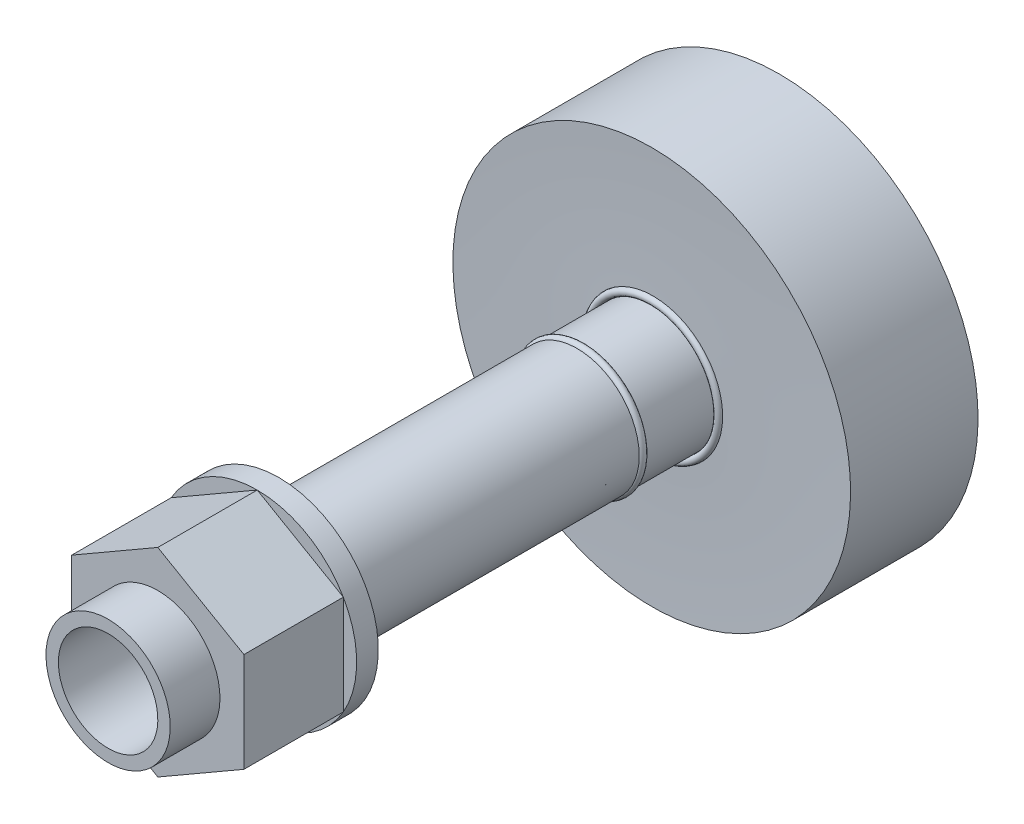
from build123d import *

# Parameters (mm, degrees)
SKETCH2_R          = 47.475732925
CUT_EXTRUDE1_DEPTH = 40
SKETCH3_W          = 3
SKETCH3_H          = 2
SKETCH3_W_2        = 2
SKETCH3_H_2        = 3
SKETCH4_W          = 2
SKETCH4_H          = 3
SKETCH5_R          = 1.5
SKETCH5_R_2        = 1.464909104
SKETCH5_R_3        = 1.4
SKETCH5_R_4        = 1.438808622


with BuildPart() as part:
    # Sketch1 → Revolve1 (revolve)
    with BuildSketch(Plane(origin=(0, 0, 0), x_dir=(0, 0, -1), z_dir=(1, 0, 0))):
        with BuildLine():
            Line((-146.746161077, 20), (123.253838923, 20))
            Line((123.253838923, 20), (123.253838923, 80))
            Line((123.253838923, 80), (71.96969697, 80))
            ThreePointArc((71.96969697, 80), (72.591794071, 52.503354195), (72.457468383, 25))
            Line((72.457468383, 25), (-76.746161077, 25))
            ThreePointArc((-76.746161077, 25), (-77.355022137, 32.502843083), (-78.03030303, 40))
            Line((-78.03030303, 40), (-126.746161077, 40))
            Line((-126.746161077, 40), (-126.746161077, 25))
            Line((-126.746161077, 25), (-146.746161077, 25))
            Line((-146.746161077, 25), (-146.746161077, 20))
        make_face()
    revolve(axis=Axis((0, 0, -123.253838923), (0, 0, 1)))

    # Sketch2 → Cut-Extrude1 (cut)
    with BuildSketch(Plane.XY.offset(126.746161077)):
        Circle(SKETCH2_R)
        Polygon((34.641016151, -20), (34.641016151, 20), (0, 40), (-34.641016151, 20), (-34.641016151, -20), (0, -40), align=None, mode=Mode.SUBTRACT)
    extrude(amount=-CUT_EXTRUDE1_DEPTH, mode=Mode.SUBTRACT)

    # Sketch3 → Cut-Revolve1 (revolve, cut)
    with BuildSketch(Plane(origin=(0, 0, 0), x_dir=(1, 0, 0), z_dir=(0, 1, 0))):
        with Locations((26.5, 72.96969697)):
            Rectangle(SKETCH3_W, SKETCH3_H)
        with Locations((24, 43.430612265)):
            Rectangle(SKETCH3_W_2, SKETCH3_H_2)
        with Locations((26.5, -77.746161077)):
            Rectangle(SKETCH3_W, SKETCH3_H)
    revolve(axis=Axis((0, 0, 0), (0, 0, -1)), mode=Mode.SUBTRACT)

    # Sketch4 → Cut-Revolve2 (revolve, cut)
    with BuildSketch(Plane(origin=(0, 0, 0), x_dir=(1, 0, 0), z_dir=(0, 1, 0))):
        with Locations((20.998754541, -92.205859438)):
            Rectangle(SKETCH4_W, SKETCH4_H)
        with Locations((20.998754541, 86.224989527)):
            Rectangle(SKETCH4_W, SKETCH4_H)
    revolve(axis=Axis((0, 0, -154.641449096), (0, 0, 1)), mode=Mode.SUBTRACT)

    # Sketch5 → Revolve2 (revolve)
    with BuildSketch(Plane(origin=(0, 0, 0), x_dir=(1, 0, 0), z_dir=(0, 1, 0))):
        with Locations((24.5, 43.430612265)):
            Circle(SKETCH5_R)
        with Locations((26.503158442, 72.508881384)):
            Circle(SKETCH5_R_2)
        with Locations((20.492344319, 86.242107482)):
            Circle(SKETCH5_R_3)
        with Locations((26.503158442, -77.264793694)):
            Circle(SKETCH5_R_4)
        with Locations((20.492344319, -92.249545542)):
            Circle(SKETCH5_R_3)
    revolve(axis=Axis((0, 0, -162.722824805), (0, 0, 1)))


with BuildPart() as revolve2_piece_1:
    # of the separate pieces the step leaves, piece 1, a body of its own (revolve2_pieces)
    add(part.part.solids().sort_by_distance((0, 20, 146.746161077))[0])


with BuildPart() as revolve2_piece_2:
    # of the separate pieces the step leaves, piece 2, a body of its own (revolve2_pieces)
    add(part.part.solids().sort_by_distance((26, 0, -43.430612265))[0])


with BuildPart() as revolve2_piece_3:
    # of the separate pieces the step leaves, piece 3, a body of its own (revolve2_pieces)
    add(part.part.solids().sort_by_distance((27.941967064, 0, 77.264793694))[0])


with BuildPart() as revolve2_piece_4:
    # of the separate pieces the step leaves, piece 4, a body of its own (revolve2_pieces)
    add(part.part.solids().sort_by_distance((21.892344319, 0, -86.242107482))[0])


with BuildPart() as revolve2_piece_5:
    # of the separate pieces the step leaves, piece 5, a body of its own (revolve2_pieces)
    add(part.part.solids().sort_by_distance((21.892344319, 0, 92.249545542))[0])


solid = Compound([revolve2_piece_1.part, revolve2_piece_2.part, revolve2_piece_3.part, revolve2_piece_4.part, revolve2_piece_5.part])
